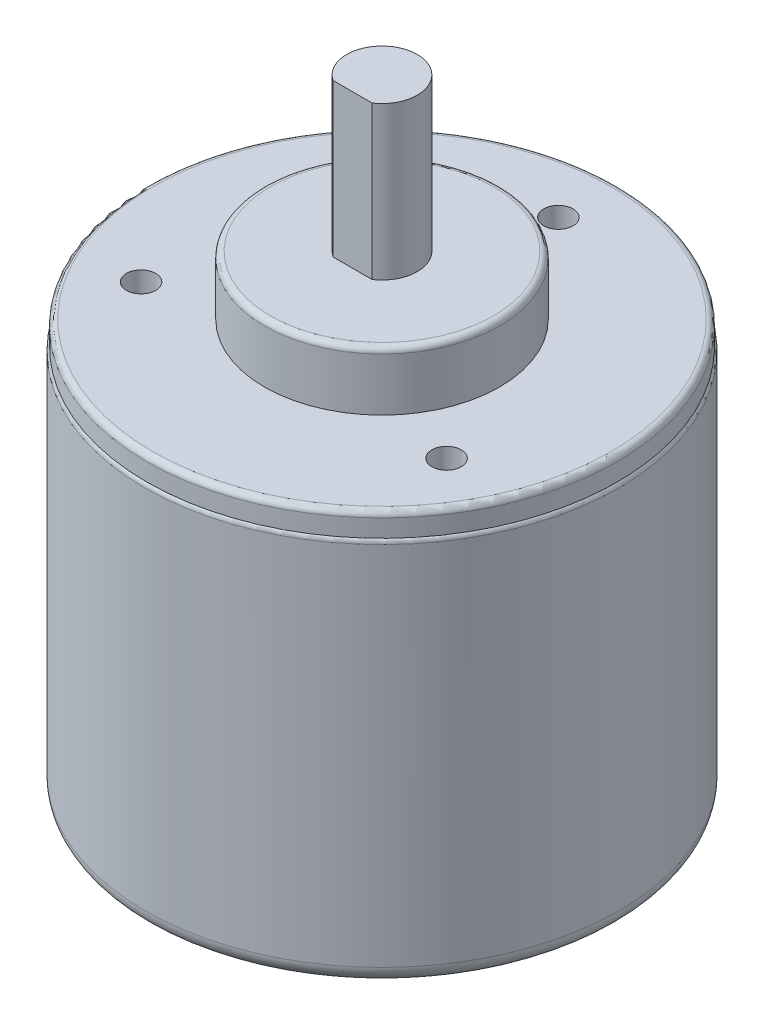
from build123d import *

# Parameters (mm, degrees)
SKETCH1_R                 = 20
BOSS_EXTRUDE1_DEPTH       = 2
SKETCH4_R                 = 20.15
BOSS_EXTRUDE3_DEPTH       = 33
SKETCH5_R                 = 10
BOSS_EXTRUDE4_DEPTH       = 5
BOSS_EXTRUDE5_DEPTH       = 13
FILLET2_R                 = 0.5
FILLET3_R                 = 1.5
M3X0_5_TAPPED_HOLE1_D     = 2.5
M3X0_5_TAPPED_HOLE1_DEPTH = 5.5
M3X0_5_TAPPED_HOLE1_TIP   = 0.751075774


with BuildPart() as part:
    # Sketch1 → Boss-Extrude1 (new body)
    with BuildSketch(Plane(origin=(0, 0, 0), x_dir=(1, 0, 0), z_dir=(0, 1, 0))):
        with Locations(Location((0, 0, 0), (0, 0, 270))):
            Circle(SKETCH1_R)
    extrude(amount=-BOSS_EXTRUDE1_DEPTH)

    # Sketch4 → Boss-Extrude3 (add)
    with BuildSketch(Plane.XZ.offset(2)):
        with Locations(Location((0, 0, 0), (0, 0, 270))):
            Circle(SKETCH4_R)
    extrude(amount=BOSS_EXTRUDE3_DEPTH)

    # Sketch5 → Boss-Extrude4 (add)
    with BuildSketch(Plane(origin=(0, 0, 0), x_dir=(1, 0, 0), z_dir=(0, 1, 0))):
        with Locations(Location((0, 0, 0), (0, 0, 270))):
            Circle(SKETCH5_R)
    extrude(amount=BOSS_EXTRUDE4_DEPTH)

    # Sketch7 → Boss-Extrude5 (add)
    with BuildSketch(Plane(origin=(0, 5, 0), x_dir=(1, 0, 0), z_dir=(0, 1, 0))):
        with BuildLine():
            Line((-1.658312395, -2.5), (1.658312395, -2.5))
            ThreePointArc((1.658312395, -2.5), (0, 3), (-1.658312395, -2.5))
        make_face()
    extrude(amount=BOSS_EXTRUDE5_DEPTH)

    # Fillet2
    # the kernel refuses this fillet: 0.5 mm, written as the material it takes off along each edge
    with BuildSketch(Plane(origin=(0, 5, 0), x_dir=(0, 0, 1), z_dir=(-1, 0, 0))) as fillet2_piece_1:
        with BuildLine():
            CenterArc((10 - FILLET2_R, -FILLET2_R), FILLET2_R, 0, 90)
            Line((10 - FILLET2_R, 0), (10 - FILLET2_R, FILLET2_R * 0.02))
            Line((10 - FILLET2_R, FILLET2_R * 0.02), (10 + FILLET2_R * 0.02, FILLET2_R * 0.02))
            Line((10 + FILLET2_R * 0.02, FILLET2_R * 0.02), (10 + FILLET2_R * 0.02, -FILLET2_R))
            Line((10 + FILLET2_R * 0.02, -FILLET2_R), (10, -FILLET2_R))
        make_face()
    revolve(axis=Axis((0, 5, 0), (0, 1, 0)), mode=Mode.SUBTRACT)
    with BuildSketch(Plane(origin=(0, 0, 0), x_dir=(0, 0, 1), z_dir=(-1, 0, 0))) as fillet2_piece_2:
        with BuildLine():
            CenterArc((20 - FILLET2_R, -FILLET2_R), FILLET2_R, 0, 90)
            Line((20 - FILLET2_R, 0), (20 - FILLET2_R, FILLET2_R * 0.02))
            Line((20 - FILLET2_R, FILLET2_R * 0.02), (20 + FILLET2_R * 0.02, FILLET2_R * 0.02))
            Line((20 + FILLET2_R * 0.02, FILLET2_R * 0.02), (20 + FILLET2_R * 0.02, -FILLET2_R))
            Line((20 + FILLET2_R * 0.02, -FILLET2_R), (20, -FILLET2_R))
        make_face()
    revolve(axis=Axis((0, 0, 0), (0, 1, 0)), mode=Mode.SUBTRACT)
    with BuildSketch(Plane(origin=(0, -2, 0), x_dir=(0, 0, -1), z_dir=(-1, 0, 0))) as fillet2_piece_3:
        with BuildLine():
            CenterArc((19.65, 0.357071421), FILLET2_R, 314.427004001, 45.572995999)
            Line((20, 0), (20.007, -0.007141428))
            ThreePointArc((20.007, -0.007141428), (20.075, -0.01), (20.15, -0.01))
            Line((20.15, -0.01), (20.16, 0))
            Line((20.16, 0), (20.16, 0.357071421))
            Line((20.16, 0.357071421), (20.15, 0.357071421))
        make_face()
    revolve(axis=Axis((0, -2, 0), (0, -1, 0)), mode=Mode.SUBTRACT)

    # Fillet3
    fillet3_edges = [part.edges().sort_by_distance(p)[0] for p in [
        (0, -35, 20.15),
    ]]
    fillet(fillet3_edges, radius=FILLET3_R)

    # M3x0.5 Tapped Hole1
    with Locations(Plane(origin=(0, 0, 0), x_dir=(1, 0, 0), z_dir=(0, 1, 0))):
        with Locations((0, 15), (12.990381057, -7.5), (-12.990381057, -7.5)):
            Hole(M3X0_5_TAPPED_HOLE1_D / 2, depth=M3X0_5_TAPPED_HOLE1_DEPTH)
            with Locations((0, 0, -(M3X0_5_TAPPED_HOLE1_DEPTH + M3X0_5_TAPPED_HOLE1_TIP / 2))):  # 118° drill point
                Cone(0, M3X0_5_TAPPED_HOLE1_D / 2, M3X0_5_TAPPED_HOLE1_TIP, mode=Mode.SUBTRACT)


solid = part.part
